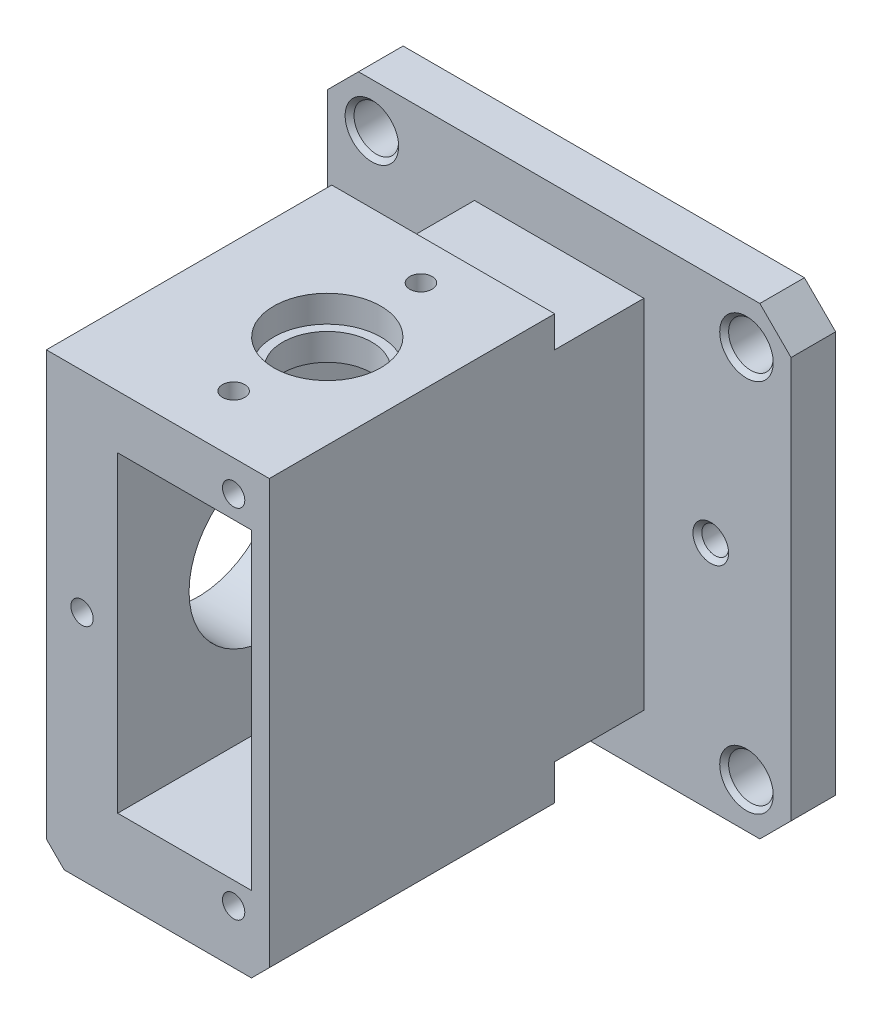
from build123d import *

# Parameters (mm, degrees)
SKETCH_1_W          = 52
SKETCH_1_H          = 52
EXTRUDE_1_DEPTH     = 5
SKETCH_2_R          = 2.5
CUT_EXTRUDE_1_DEPTH = 38.107950631
CHAMFER_1_SIZE      = 3.5
CHAMFER_2_SIZE      = 0.5
SKETCH_3_W          = 19
SKETCH_3_H          = 40
EXTRUDE_2_DEPTH     = 42
SKETCH_4_W          = 25
SKETCH_4_H          = 52
EXTRUDE_3_DEPTH     = 32
SKETCH_6_W          = 15
SKETCH_6_H          = 35
CUT_EXTRUDE_2_DEPTH = 60.674114991
CUT_EXTRUDE_3_REACH = 69.877
SKETCH_7_R          = 9
M3X0_51_D           = 2.5
M3X0_51_DEPTH       = 5.5
M3X0_51_TIP         = 0.751075774
CHAMFER_3_SIZE      = 2
M3X0_52_D           = 2.5
M3X0_52_DEPTH       = 5.5
M3X0_52_TIP         = 0.751075774
SKETCH_13_R         = 3.1
CUT_EXTRUDE_4_DEPTH = 7
CUT_EXTRUDE_5_REACH = 72.071
SKETCH_14_R         = 1.55
CHAMFER_4_SIZE      = 1
SKETCH_15_W         = 25
SKETCH_15_H         = 32
CUT_EXTRUDE_6_DEPTH = 2.5
SKETCH_16_R         = 6
CUT_EXTRUDE_7_DEPTH = 3
CUT_EXTRUDE_8_REACH = 73.044
SKETCH_17_R         = 5
M3X0_53_D           = 2.5
M3X0_53_DEPTH       = 4.5
M3X0_53_TIP         = 0.751075774
CUT_EXTRUDE_9_REACH = 61.674
SKETCH_20_R         = 1.5
CHAMFER_5_SIZE      = 0.5


with BuildPart() as part:
    # Эскиз1 → Бобышка-Вытянуть1 (new body)
    with BuildSketch(Plane.XY):
        Rectangle(SKETCH_1_W, SKETCH_1_H)
    extrude(amount=EXTRUDE_1_DEPTH)

    # Эскиз2 → Вырез-Вытянуть1 (cut, through all)
    with BuildSketch(Plane.XY.offset(5)):
        with Locations((-21, -21)):
            Circle(SKETCH_2_R)
        with Locations((21, -21)):
            Circle(SKETCH_2_R)
        with Locations((-21, 21)):
            Circle(SKETCH_2_R)
        with Locations((21, 21)):
            Circle(SKETCH_2_R)
    extrude(amount=-CUT_EXTRUDE_1_DEPTH, mode=Mode.SUBTRACT)

    # Фаска1
    chamfer_1_edges = [part.edges().sort_by_distance(p)[0] for p in [
        (-26, 26, 2.5),
        (26, 26, 2.5),
        (26, -26, 2.5),
        (-26, -26, 2.5),
    ]]
    chamfer(chamfer_1_edges, length=CHAMFER_1_SIZE)

    # Фаска2
    chamfer_2_edges = [part.edges().sort_by_distance(p)[0] for p in [
        (18.5, -21, 5),
        (18.5, 21, 5),
        (-23.5, 21, 5),
        (-23.5, -21, 5),
    ]]
    chamfer(chamfer_2_edges, length=CHAMFER_2_SIZE)

    # Эскиз3 → Бобышка-Вытянуть2 (add)
    with BuildSketch(Plane.XY.offset(5)):
        Rectangle(SKETCH_3_W, SKETCH_3_H)
    extrude(amount=EXTRUDE_2_DEPTH)

    # Эскиз4 → Бобышка-Вытянуть3 (add)
    with BuildSketch(Plane.XY.offset(47)):
        with Locations((-3, 0)):
            Rectangle(SKETCH_4_W, SKETCH_4_H)
    extrude(amount=-EXTRUDE_3_DEPTH)

    # Эскиз6 → Вырез-Вытянуть2 (cut, through all)
    with BuildSketch(Plane.XY.offset(47)):
        Rectangle(SKETCH_6_W, SKETCH_6_H)
    extrude(amount=-CUT_EXTRUDE_2_DEPTH, mode=Mode.SUBTRACT)

    # Эскиз7 → Вырез-Вытянуть3 (cut, up to next)
    with BuildSketch(Plane.ZY.offset(15.5), mode=Mode.PRIVATE) as cut_extrude_3_sk1:
        with Locations((30, 0)):
            Circle(SKETCH_7_R)
    cut_extrude_3_tool1 = extrude(cut_extrude_3_sk1.sketch, amount=-CUT_EXTRUDE_3_REACH, mode=Mode.PRIVATE) & part.part
    add(cut_extrude_3_tool1.solids().sort_by_distance((-15.5, 0, 30))[0], mode=Mode.SUBTRACT)

    # Отверстие обработанное метчиком M3x0.51
    with Locations(Plane(origin=(-15.5, 11, 39), x_dir=(0, 0, -1), z_dir=(-1, 0, 0))):
        with Locations((0, 0), (0, 22), (18, 22), (18, 0)):
            Hole(M3X0_51_D / 2, depth=M3X0_51_DEPTH)
            with Locations((0, 0, -(M3X0_51_DEPTH + M3X0_51_TIP / 2))):  # 118° drill point
                Cone(0, M3X0_51_D / 2, M3X0_51_TIP, mode=Mode.SUBTRACT)

    # Фаска3
    chamfer_3_edges = [part.edges().sort_by_distance(p)[0] for p in [
        (9.5, -26, 31),
        (9.5, 26, 31),
        (-15.5, 26, 31),
        (-15.5, -26, 31),
    ]]
    chamfer(chamfer_3_edges, length=CHAMFER_3_SIZE)

    # Отверстие обработанное метчиком M3x0.52
    with Locations(Plane(origin=(5.5, 20, 47), x_dir=(1, 0, 0), z_dir=(0, 0, 1))):
        with Locations((0, 0), (-17, -20), (0, -40)):
            Hole(M3X0_52_D / 2, depth=M3X0_52_DEPTH)
            with Locations((0, 0, -(M3X0_52_DEPTH + M3X0_52_TIP / 2))):  # 118° drill point
                Cone(0, M3X0_52_D / 2, M3X0_52_TIP, mode=Mode.SUBTRACT)

    # Эскиз13 → Вырез-Вытянуть4 (cut)
    with BuildSketch(Plane(origin=(0, -26, 0), x_dir=(-1, 0, 0), z_dir=(0, -1, 0))):
        with Locations((1, -30)):
            Circle(SKETCH_13_R)
    extrude(amount=-CUT_EXTRUDE_4_DEPTH, mode=Mode.SUBTRACT)

    # Эскиз14 → Вырез-Вытянуть5 (cut, up to next)
    with BuildSketch(Plane.XZ.offset(19), mode=Mode.PRIVATE) as cut_extrude_5_sk1:
        with Locations((-1, 30)):
            Circle(SKETCH_14_R)
    cut_extrude_5_tool1 = extrude(cut_extrude_5_sk1.sketch, amount=-CUT_EXTRUDE_5_REACH, mode=Mode.PRIVATE) & part.part
    add(cut_extrude_5_tool1.solids().sort_by_distance((-1, -19, 30))[0], mode=Mode.SUBTRACT)

    # Фаска4
    chamfer_4_edges = [part.edges().sort_by_distance(p)[0] for p in [
        (2.1, -26, 30),
    ]]
    chamfer(chamfer_4_edges, length=CHAMFER_4_SIZE)

    # Эскиз15 → Вырез-Вытянуть6 (cut)
    with BuildSketch(Plane(origin=(0, 26, 0), x_dir=(1, 0, 0), z_dir=(0, 1, 0))):
        with Locations((-3, -31)):
            Rectangle(SKETCH_15_W, SKETCH_15_H)
    extrude(amount=-CUT_EXTRUDE_6_DEPTH, mode=Mode.SUBTRACT)

    # Эскиз16 → Вырез-Вытянуть7 (cut)
    with BuildSketch(Plane(origin=(0, 23.5, 0), x_dir=(1, 0, 0), z_dir=(0, 1, 0))):
        with Locations((-1, -30)):
            Circle(SKETCH_16_R)
    extrude(amount=-CUT_EXTRUDE_7_DEPTH, mode=Mode.SUBTRACT)

    # Эскиз17 → Вырез-Вытянуть8 (cut, up to next)
    with BuildSketch(Plane(origin=(0, 20.5, 0), x_dir=(1, 0, 0), z_dir=(0, 1, 0)), mode=Mode.PRIVATE) as cut_extrude_8_sk1:
        with Locations((-1, -30)):
            Circle(SKETCH_17_R)
    cut_extrude_8_tool1 = extrude(cut_extrude_8_sk1.sketch, amount=-CUT_EXTRUDE_8_REACH, mode=Mode.PRIVATE) & part.part
    add(cut_extrude_8_tool1.solids().sort_by_distance((-1, 20.5, 30))[0], mode=Mode.SUBTRACT)

    # Отверстие обработанное метчиком M3x0.53
    with Locations(Plane(origin=(-1, 23.5, 40.5), x_dir=(0, 0, 1), z_dir=(0, 1, 0))):
        with Locations((0, 0), (-21, 0)):
            Hole(M3X0_53_D / 2, depth=M3X0_53_DEPTH)
            with Locations((0, 0, -(M3X0_53_DEPTH + M3X0_53_TIP / 2))):  # 118° drill point
                Cone(0, M3X0_53_D / 2, M3X0_53_TIP, mode=Mode.SUBTRACT)

    # Эскиз20 → Вырез-Вытянуть9 (cut, up to next)
    with BuildSketch(Plane(origin=(0, 0, 0), x_dir=(-1, 0, 0), z_dir=(0, 0, -1)), mode=Mode.PRIVATE) as cut_extrude_9_sk1:
        with Locations((-17, 0)):
            Circle(SKETCH_20_R)
    cut_extrude_9_tool1 = extrude(cut_extrude_9_sk1.sketch, amount=-CUT_EXTRUDE_9_REACH, mode=Mode.PRIVATE) & part.part
    # Эскиз20 → Вырез-Вытянуть9 (cut, up to next)
    with BuildSketch(Plane(origin=(0, 0, 0), x_dir=(-1, 0, 0), z_dir=(0, 0, -1)), mode=Mode.PRIVATE) as cut_extrude_9_sk2:
        with Locations((17, 0)):
            Circle(SKETCH_20_R)
    cut_extrude_9_tool2 = extrude(cut_extrude_9_sk2.sketch, amount=-CUT_EXTRUDE_9_REACH, mode=Mode.PRIVATE) & part.part
    add(cut_extrude_9_tool1.solids().sort_by_distance((17, 0, 0))[0], mode=Mode.SUBTRACT)
    add(cut_extrude_9_tool2.solids().sort_by_distance((-17, 0, 0))[0], mode=Mode.SUBTRACT)

    # Фаска5
    chamfer_5_edges = [part.edges().sort_by_distance(p)[0] for p in [
        (18.5, 0, 5),
        (-15.5, 0, 5),
    ]]
    chamfer(chamfer_5_edges, length=CHAMFER_5_SIZE)


solid = part.part
